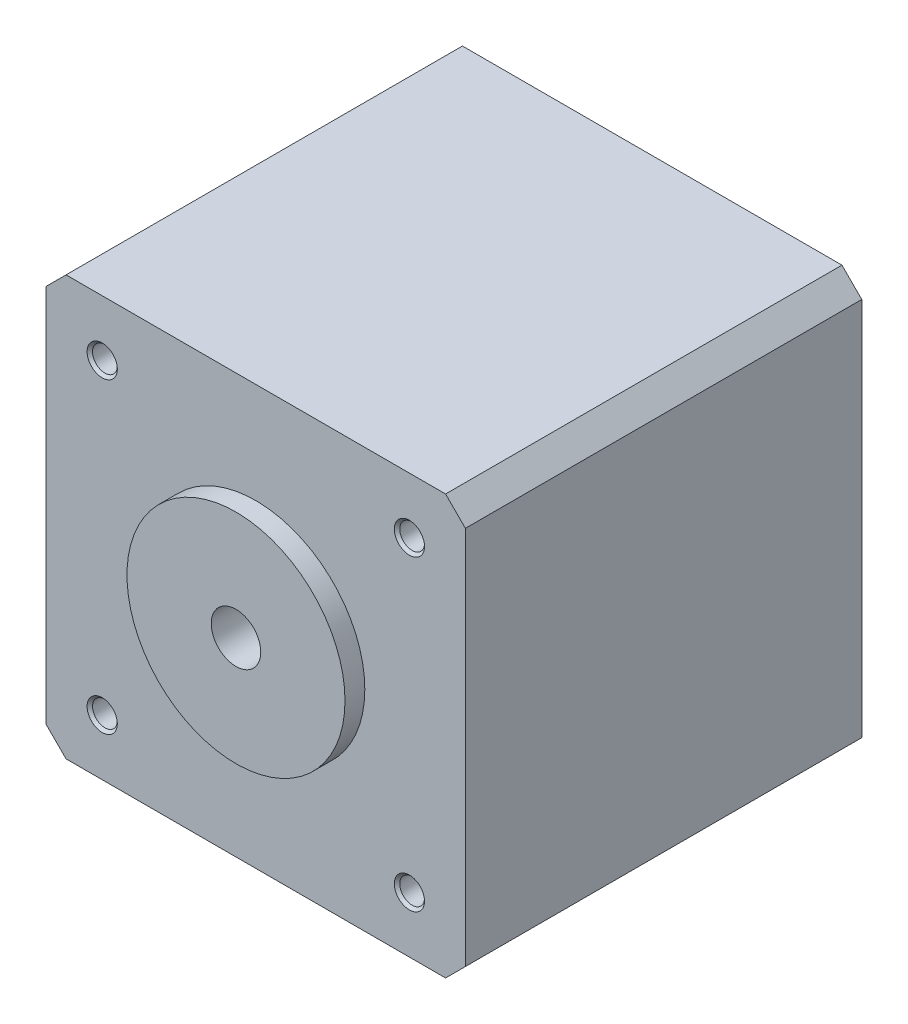
from build123d import *

# Parameters (mm, degrees)
SKETCH_1_W                   = 42.3
SKETCH_1_H                   = 42.3
EXTRUDE_1_DEPTH              = 40
HOLE_WIZARD_M3_1_D           = 2.5
HOLE_WIZARD_M3_1_DEPTH       = 8.5
HOLE_WIZARD_M3_1_CSINK_D     = 3.05
HOLE_WIZARD_M3_1_CSINK_ANGLE = 90
HOLE_WIZARD_M3_1_TIP         = 0.751075774
SKETCH_6_R                   = 11
EXTRUDE_2_DEPTH              = 2
SKETCH_7_R                   = 2.5
CUT_EXTRUDE_1_DEPTH          = 54.203806255
CHAMFER_1_SIZE               = 2


with BuildPart() as part:
    # 스케치1 → 보스-돌출1 (new body)
    with BuildSketch(Plane.XY):
        Rectangle(SKETCH_1_W, SKETCH_1_H)
    extrude(amount=EXTRUDE_1_DEPTH)

    # M3 나사 구멍1
    with Locations(Plane.XY.offset(40)):
        with Locations((-15.5, 15.5), (15.5, 15.5), (15.5, -15.5), (-15.5, -15.5)):
            CounterSinkHole(HOLE_WIZARD_M3_1_D / 2, HOLE_WIZARD_M3_1_CSINK_D / 2, depth=HOLE_WIZARD_M3_1_DEPTH, counter_sink_angle=HOLE_WIZARD_M3_1_CSINK_ANGLE)
            with Locations((0, 0, -(HOLE_WIZARD_M3_1_DEPTH + HOLE_WIZARD_M3_1_TIP / 2))):  # 118° drill point
                Cone(0, HOLE_WIZARD_M3_1_D / 2, HOLE_WIZARD_M3_1_TIP, mode=Mode.SUBTRACT)

    # 스케치6 → 보스-돌출2 (add)
    with BuildSketch(Plane.XY.offset(40)):
        Circle(SKETCH_6_R)
    extrude_2 = extrude(amount=EXTRUDE_2_DEPTH)

    # 대칭 복사1: 보스-돌출2 across plane
    add(extrude_2.mirror(Plane(origin=(0, 0, 20), x_dir=(1, 0, 0), z_dir=(0, 0, -1))))

    # 스케치7 → 컷-돌출1 (cut, through all)
    with BuildSketch(Plane.XY.offset(42)):
        Circle(SKETCH_7_R)
    extrude(amount=-CUT_EXTRUDE_1_DEPTH, mode=Mode.SUBTRACT)

    # 모따기1
    chamfer_1_edges = [part.edges().sort_by_distance(p)[0] for p in [
        (-21.15, -21.15, 20),
        (21.15, -21.15, 20),
        (21.15, 21.15, 20),
        (-21.15, 21.15, 20),
    ]]
    chamfer(chamfer_1_edges, length=CHAMFER_1_SIZE)


solid = part.part
